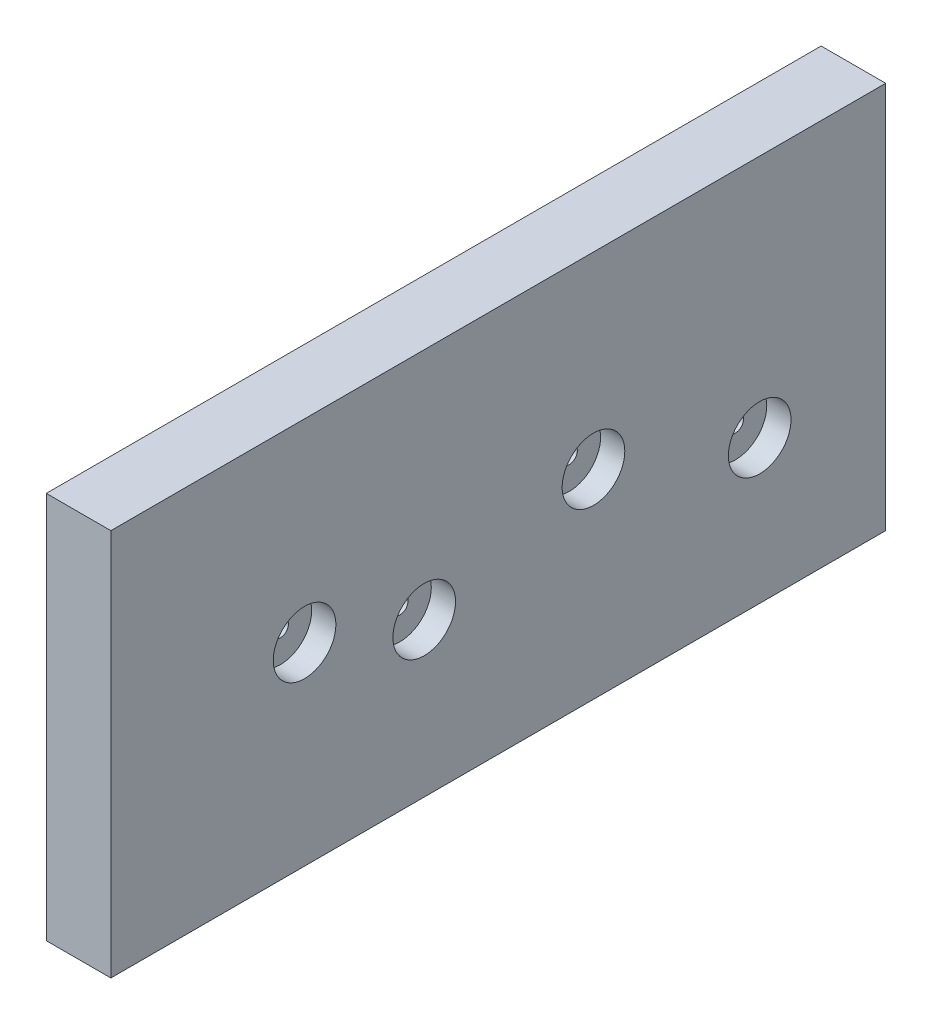
from build123d import *

# Parameters (mm, degrees)
SKETCH1_W                       = 152.4
SKETCH1_H                       = 76.2
SKETCH1_R                       = 1.5875
BOSS_EXTRUDE1_DEPTH             = 12.7
SKETCH2_R                       = 6.1595
CUT_EXTRUDE1_DEPTH              = 4.7625
F_1_4_0_25_DIAMETER_HOLE1_D     = 6.35
F_1_4_0_25_DIAMETER_HOLE1_DEPTH = 38.1
F_1_4_0_25_DIAMETER_HOLE1_TIP   = 1.907732465


with BuildPart() as part:
    # Sketch1 → Boss-Extrude1 (new body)
    with BuildSketch(Plane(origin=(0, 0, 0), x_dir=(0, 0, -1), z_dir=(1, 0, 0))):
        Rectangle(SKETCH1_W, SKETCH1_H)
        with Locations((18.72253158, 1.096077429)):
            Circle(SKETCH1_R, mode=Mode.SUBTRACT)
        with Locations((-38.1, 0)):
            Circle(SKETCH1_R, mode=Mode.SUBTRACT)
        with Locations((-14.571224015, -7.860160654)):
            Circle(SKETCH1_R, mode=Mode.SUBTRACT)
        with Locations((51.408255992, -9.873506971)):
            Circle(SKETCH1_R, mode=Mode.SUBTRACT)
    extrude(amount=BOSS_EXTRUDE1_DEPTH)

    # Sketch2 → Cut-Extrude1 (cut)
    with BuildSketch(Plane.ZY.offset(-12.7)):
        with Locations((38.1, 0)):
            Circle(SKETCH2_R)
        with Locations((14.571224015, -7.860160654)):
            Circle(SKETCH2_R)
        with Locations((-18.72253158, 1.096077429)):
            Circle(SKETCH2_R)
        with Locations((-51.408255992, -9.873506971)):
            Circle(SKETCH2_R)
    extrude(amount=CUT_EXTRUDE1_DEPTH, mode=Mode.SUBTRACT)

    # 1/4 (0.25) Diameter Hole1
    with Locations(Plane.XZ.offset(38.1)):
        with Locations((6.35, -63.5), (6.35, 0), (6.35, 57.15)):
            Hole(F_1_4_0_25_DIAMETER_HOLE1_D / 2, depth=F_1_4_0_25_DIAMETER_HOLE1_DEPTH)
            with Locations((0, 0, -(F_1_4_0_25_DIAMETER_HOLE1_DEPTH + F_1_4_0_25_DIAMETER_HOLE1_TIP / 2))):  # 118° drill point
                Cone(0, F_1_4_0_25_DIAMETER_HOLE1_D / 2, F_1_4_0_25_DIAMETER_HOLE1_TIP, mode=Mode.SUBTRACT)


solid = part.part
